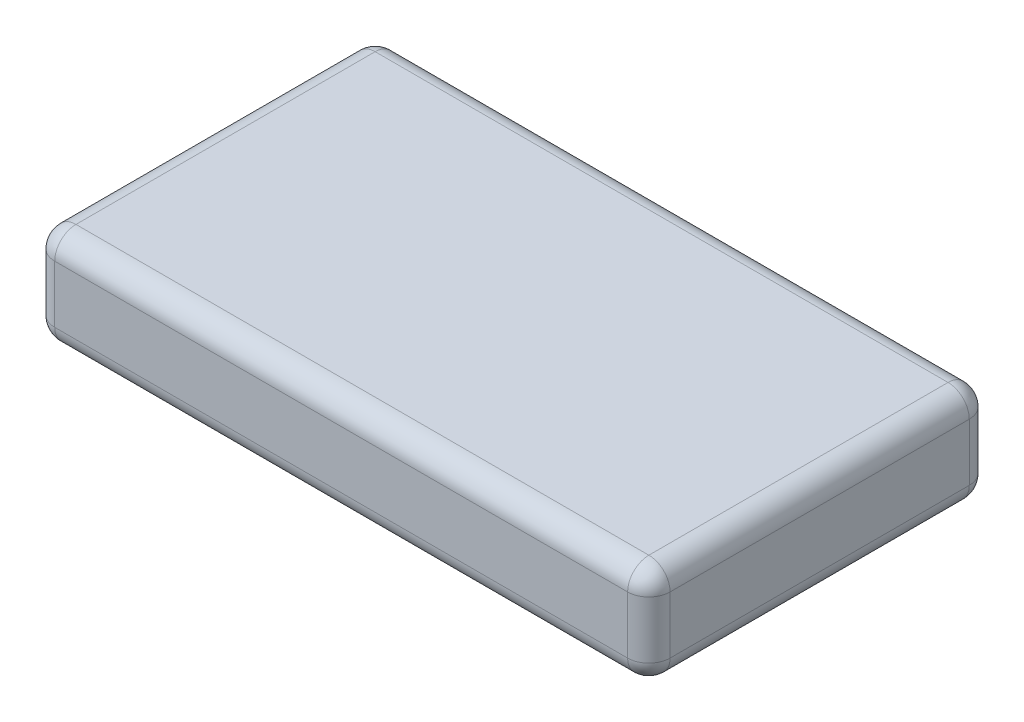
from build123d import *

# Parameters (mm, degrees)
SKETCH1_W           = 58
SKETCH1_H           = 32.2
BOSS_EXTRUDE1_DEPTH = 9.4
FILLET1_R           = 2


with BuildPart() as part:
    # Sketch1 → Boss-Extrude1 (new body)
    with BuildSketch(Plane(origin=(0, 0, 0), x_dir=(1, 0, 0), z_dir=(0, 1, 0))):
        Rectangle(SKETCH1_W, SKETCH1_H)
    extrude(amount=BOSS_EXTRUDE1_DEPTH)

    # Fillet1
    fillet1_edges = [part.edges().sort_by_distance(p)[0] for p in [
        (29, 4.7, -16.1),
        (-29, 4.7, -16.1),
        (0, 0, -16.1),
        (-29, 0, 0),
        (29, 0, 0),
        (-29, 4.7, 16.1),
        (29, 4.7, 16.1),
        (0, 0, 16.1),
        (0, 9.4, 16.1),
        (-29, 9.4, 0),
        (0, 9.4, -16.1),
        (29, 9.4, 0),
    ]]
    fillet(fillet1_edges, radius=FILLET1_R)


solid = part.part
